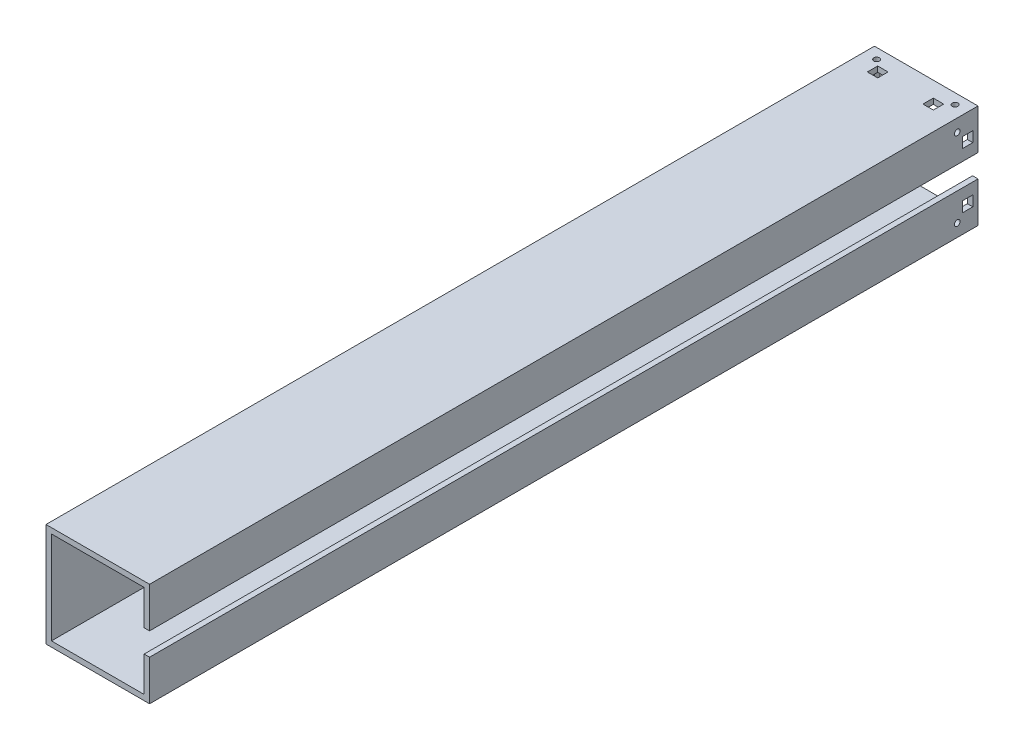
from build123d import *

# Parameters (mm, degrees)
BOSS_EXTRUDE1_DEPTH     = 508
CUT_EXTRUDE1_DEPTH      = 254
CUT_EXTRUDE1_DEPTH_BACK = 254
SKETCH2_R               = 1.75
SKETCH4_R               = 1.75
CUT_EXTRUDE2_DEPTH      = 254
SKETCH6_W               = 6.35
SKETCH6_H               = 6.35
CUT_EXTRUDE4_DEPTH      = 90.678
SKETCH7_W               = 6.35
SKETCH7_H               = 6.35
CUT_EXTRUDE5_DEPTH      = 122.174


with BuildPart() as part:
    # Sketch1 → Boss-Extrude1 (new body)
    with BuildSketch(Plane(origin=(0, 0, 0), x_dir=(0, 1, 0), z_dir=(0, 0, 1))):
        Polygon((28.41625, 28.41625), (28.41625, -28.41625), (6.985, -28.41625), (6.985, -31.75), (31.75, -31.75), (31.75, 31.75), (-31.75, 31.75), (-31.75, -31.75), (-6.985, -31.75), (-6.985, -28.41625), (-28.41625, -28.41625), (-28.41625, 28.41625), align=None)
    extrude(amount=BOSS_EXTRUDE1_DEPTH)

    # Sketch2 → Cut-Extrude1 (cut, two sides: drawn at the far end of the back side and taken through both)
    with BuildSketch(Plane(origin=(0, 0, 0), x_dir=(-1, 0, 0), z_dir=(0, 1, 0)).offset(-CUT_EXTRUDE1_DEPTH_BACK)):
        with Locations((-24.05, 6.35)):
            Circle(SKETCH2_R)
        with Locations((24.05, 6.35)):
            Circle(SKETCH2_R)
    extrude(amount=CUT_EXTRUDE1_DEPTH + CUT_EXTRUDE1_DEPTH_BACK, mode=Mode.SUBTRACT)

    # Sketch4 → Cut-Extrude2 (cut)
    with BuildSketch(Plane.YZ.offset(31.75)):
        with Locations((24.05, 12.7)):
            Circle(SKETCH4_R)
        with Locations((-24.05, 12.7)):
            Circle(SKETCH4_R)
    extrude(amount=-CUT_EXTRUDE2_DEPTH, mode=Mode.SUBTRACT)

    # Sketch6 → Cut-Extrude4 (cut)
    with BuildSketch(Plane.YZ.offset(31.75)):
        with Locations((17.05, 6.35)):
            Rectangle(SKETCH6_W, SKETCH6_H)
        with Locations((-17.05, 6.35)):
            Rectangle(SKETCH6_W, SKETCH6_H)
    extrude(amount=-CUT_EXTRUDE4_DEPTH, mode=Mode.SUBTRACT)

    # Sketch7 → Cut-Extrude5 (cut)
    with BuildSketch(Plane(origin=(0, 31.75, 0), x_dir=(-1, 0, 0), z_dir=(0, 1, 0))):
        with Locations((-17.05, 12.7)):
            Rectangle(SKETCH7_W, SKETCH7_H)
        with Locations((17.05, 12.7)):
            Rectangle(SKETCH7_W, SKETCH7_H)
    extrude(amount=-CUT_EXTRUDE5_DEPTH, mode=Mode.SUBTRACT)


solid = part.part
